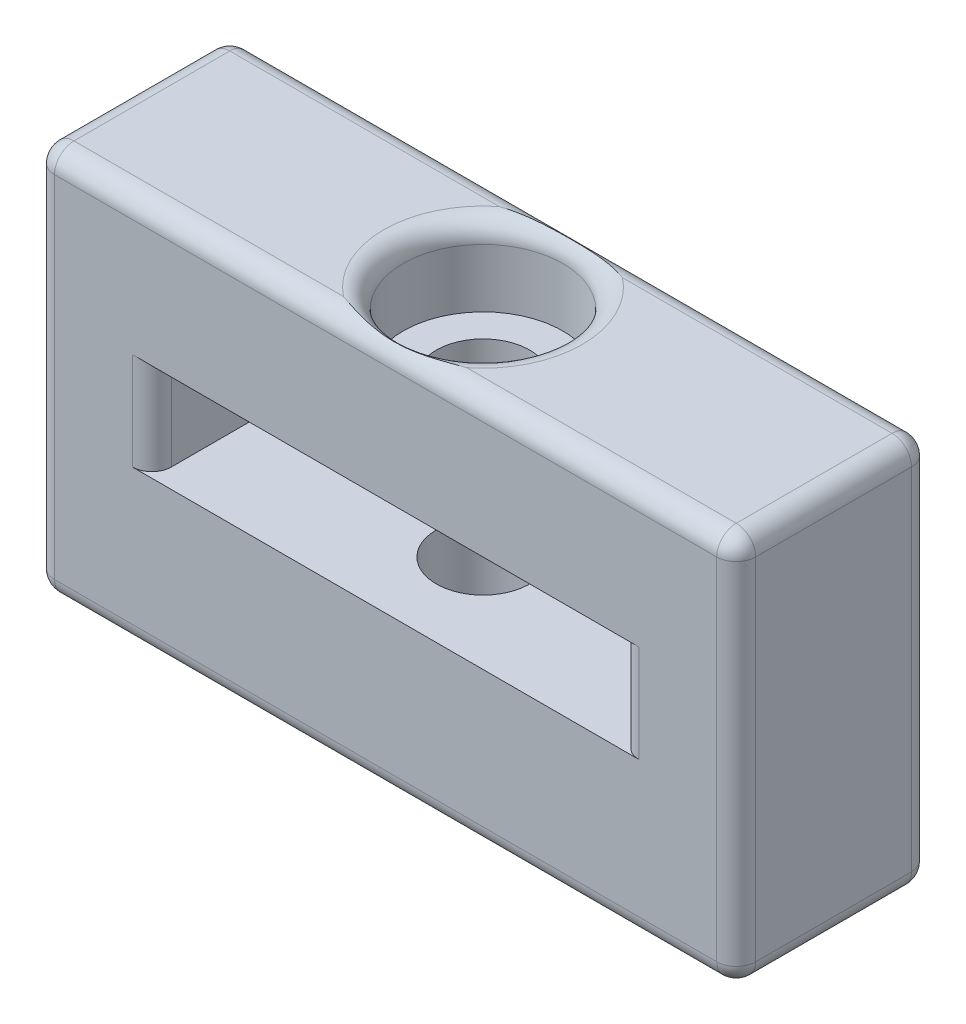
from build123d import *

# Parameters (mm, degrees)
SKETCH1_W           = 12
SKETCH1_H           = 5
BOSS_EXTRUDE1_DEPTH = 4
SKETCH2_W           = 3
SKETCH2_H           = 6.5
BOSS_EXTRUDE2_DEPTH = 5
SKETCH3_W           = 18
SKETCH3_H           = 5
BOSS_EXTRUDE3_DEPTH = 3.5
CUT_EXTRUDE1_REACH  = 15.684
SKETCH4_R           = 1.2
SKETCH5_R           = 2.05
CUT_EXTRUDE2_DEPTH  = 2
FILLET1_R           = 0.5


with BuildPart() as part:
    # Sketch1 → Boss-Extrude1 (new body)
    with BuildSketch(Plane(origin=(0, 0, 0), x_dir=(1, 0, 0), z_dir=(0, 1, 0))):
        Rectangle(SKETCH1_W, SKETCH1_H)
    extrude(amount=BOSS_EXTRUDE1_DEPTH)

    # Sketch2 → Boss-Extrude2 (add)
    with BuildSketch(Plane.XY.offset(2.5)):
        with Locations((-7.5, 3.25)):
            Rectangle(SKETCH2_W, SKETCH2_H)
        with Locations((7.5, 3.25)):
            Rectangle(SKETCH2_W, SKETCH2_H)
    extrude(amount=-BOSS_EXTRUDE2_DEPTH)

    # Sketch3 → Boss-Extrude3 (add)
    with BuildSketch(Plane(origin=(0, 6.5, 0), x_dir=(1, 0, 0), z_dir=(0, 1, 0))):
        Rectangle(SKETCH3_W, SKETCH3_H)
    extrude(amount=BOSS_EXTRUDE3_DEPTH)

    # Cut-Extrude1: up to this face of the body (flat: up to its plane)
    cut_extrude1_end = Plane(part.part.faces().sort_by_distance((0, 0, 0))[0])
    # Sketch4 → Cut-Extrude1 (cut, up to the picked face)
    with BuildSketch(Plane(origin=(0, 10, 0), x_dir=(1, 0, 0), z_dir=(0, 1, 0)), mode=Mode.PRIVATE) as cut_extrude1_sk1:
        with Locations(Location((0, 0, 0), (0, 0, 270))):
            Circle(SKETCH4_R)
    cut_extrude1_tool1 = split(extrude(cut_extrude1_sk1.sketch, amount=-CUT_EXTRUDE1_REACH, mode=Mode.PRIVATE), bisect_by=cut_extrude1_end, keep=Keep.BOTH, mode=Mode.PRIVATE)
    add(cut_extrude1_tool1.solids().sort_by(Axis((0, 10, 0), (0, -1, 0)))[0], mode=Mode.SUBTRACT)

    # Sketch5 → Cut-Extrude2 (cut)
    with BuildSketch(Plane(origin=(0, 10, 0), x_dir=(1, 0, 0), z_dir=(0, 1, 0))):
        with Locations(Location((0, 0, 0), (0, 0, 270))):
            Circle(SKETCH5_R)
    extrude(amount=-CUT_EXTRUDE2_DEPTH, mode=Mode.SUBTRACT)

    # Fillet1
    # the kernel refuses this fillet: 0.5 mm, written as the material it takes off along each edge
    with BuildSketch(Plane(origin=(-8.5, 0.5, 2), x_dir=(0, -1, 0), z_dir=(0, 0, 1))) as fillet1_piece_1_section:
        Polygon((0, 0), (FILLET1_R, 0), (FILLET1_R, -FILLET1_R), (0, -FILLET1_R), align=None)
    fillet1_piece_1 = extrude(amount=FILLET1_R, mode=Mode.PRIVATE)
    fillet1_piece_1 = fillet1_piece_1 - Plane(origin=(-8.5, 0.5, 2), x_dir=(0.7071067811865475, 0.7071067811865475, 0), z_dir=(0, 0, 1)) * Sphere(FILLET1_R, mode=Mode.PRIVATE)
    add(fillet1_piece_1, mode=Mode.SUBTRACT)
    with BuildSketch(Plane(origin=(-8.5, 0.5, -2), x_dir=(-1, 0, 0), z_dir=(0, -1, 0))) as fillet1_piece_2_section:
        Polygon((0, 0), (FILLET1_R, 0), (FILLET1_R, FILLET1_R), (0, FILLET1_R), align=None)
    fillet1_piece_2 = extrude(amount=FILLET1_R, mode=Mode.PRIVATE)
    fillet1_piece_2 = fillet1_piece_2 - Plane(origin=(-8.5, 0.5, -2), x_dir=(0.7071067811865475, 0, 0.7071067811865475), z_dir=(0, -1, 0)) * Sphere(FILLET1_R, mode=Mode.PRIVATE)
    add(fillet1_piece_2, mode=Mode.SUBTRACT)
    with BuildSketch(Plane(origin=(-8.5, 9.5, 2), x_dir=(-1, 0, 0), z_dir=(0, 0, 1))) as fillet1_piece_3_section:
        Polygon((0, 0), (FILLET1_R, 0), (FILLET1_R, -FILLET1_R), (0, -FILLET1_R), align=None)
    fillet1_piece_3 = extrude(amount=FILLET1_R, mode=Mode.PRIVATE)
    fillet1_piece_3 = fillet1_piece_3 - Plane(origin=(-8.5, 9.5, 2), x_dir=(0.7071067811865475, -0.7071067811865475, 0), z_dir=(0, 0, 1)) * Sphere(FILLET1_R, mode=Mode.PRIVATE)
    add(fillet1_piece_3, mode=Mode.SUBTRACT)
    with BuildSketch(Plane(origin=(-8.5, 9.5, -2), x_dir=(-1, 0, 0), z_dir=(0, 0, -1))) as fillet1_piece_4_section:
        Polygon((0, 0), (FILLET1_R, 0), (FILLET1_R, FILLET1_R), (0, FILLET1_R), align=None)
    fillet1_piece_4 = extrude(amount=FILLET1_R, mode=Mode.PRIVATE)
    fillet1_piece_4 = fillet1_piece_4 - Plane(origin=(-8.5, 9.5, -2), x_dir=(0.7071067811865475, -0.7071067811865475, 0), z_dir=(0, 0, -1)) * Sphere(FILLET1_R, mode=Mode.PRIVATE)
    add(fillet1_piece_4, mode=Mode.SUBTRACT)
    with BuildSketch(Plane(origin=(8.5, 0.5, 2), x_dir=(0, -1, 0), z_dir=(0, 0, 1))) as fillet1_piece_5_section:
        Polygon((0, 0), (FILLET1_R, 0), (FILLET1_R, FILLET1_R), (0, FILLET1_R), align=None)
    fillet1_piece_5 = extrude(amount=FILLET1_R, mode=Mode.PRIVATE)
    fillet1_piece_5 = fillet1_piece_5 - Plane(origin=(8.5, 0.5, 2), x_dir=(-0.7071067811865476, 0.7071067811865475, 0), z_dir=(0, 0, 1)) * Sphere(FILLET1_R, mode=Mode.PRIVATE)
    add(fillet1_piece_5, mode=Mode.SUBTRACT)
    with BuildSketch(Plane(origin=(8.5, 0.5, -2), x_dir=(1, 0, 0), z_dir=(0, -1, 0))) as fillet1_piece_6_section:
        Polygon((0, 0), (FILLET1_R, 0), (FILLET1_R, -FILLET1_R), (0, -FILLET1_R), align=None)
    fillet1_piece_6 = extrude(amount=FILLET1_R, mode=Mode.PRIVATE)
    fillet1_piece_6 = fillet1_piece_6 - Plane(origin=(8.5, 0.5, -2), x_dir=(-0.7071067811865475, 0, 0.7071067811865475), z_dir=(0, -1, 0)) * Sphere(FILLET1_R, mode=Mode.PRIVATE)
    add(fillet1_piece_6, mode=Mode.SUBTRACT)
    with BuildSketch(Plane(origin=(8.5, 9.5, 2), x_dir=(0, 1, 0), z_dir=(0, 0, 1))) as fillet1_piece_7_section:
        Polygon((0, 0), (FILLET1_R, 0), (FILLET1_R, -FILLET1_R), (0, -FILLET1_R), align=None)
    fillet1_piece_7 = extrude(amount=FILLET1_R, mode=Mode.PRIVATE)
    fillet1_piece_7 = fillet1_piece_7 - Plane(origin=(8.5, 9.5, 2), x_dir=(-0.7071067811865475, -0.7071067811865477, 0), z_dir=(0, 0, 1)) * Sphere(FILLET1_R, mode=Mode.PRIVATE)
    add(fillet1_piece_7, mode=Mode.SUBTRACT)
    with BuildSketch(Plane(origin=(8.5, 9.5, -2), x_dir=(0, 1, 0), z_dir=(0, 0, -1))) as fillet1_piece_8_section:
        Polygon((0, 0), (FILLET1_R, 0), (FILLET1_R, FILLET1_R), (0, FILLET1_R), align=None)
    fillet1_piece_8 = extrude(amount=FILLET1_R, mode=Mode.PRIVATE)
    fillet1_piece_8 = fillet1_piece_8 - Plane(origin=(8.5, 9.5, -2), x_dir=(-0.7071067811865475, -0.7071067811865477, 0), z_dir=(0, 0, -1)) * Sphere(FILLET1_R, mode=Mode.PRIVATE)
    add(fillet1_piece_8, mode=Mode.SUBTRACT)
    with BuildSketch(Plane(origin=(-9, 0, 2), x_dir=(1, 0, 0), z_dir=(0, 0, -1)), Plane(origin=(-9, 10, 2), x_dir=(0, -1, 0), z_dir=(0, 0, -1))) as fillet1_piece_9:
        with BuildLine():
            CenterArc((FILLET1_R, -FILLET1_R), FILLET1_R, 90, 90)
            Line((0, -FILLET1_R), (0, 0))
            Line((0, 0), (FILLET1_R, 0))
        make_face()
    extrude(amount=4, mode=Mode.SUBTRACT)
    with BuildSketch(Plane(origin=(-6, 4, 2.5), x_dir=(-1, 0, 0), z_dir=(0, 1, 0)), Plane(origin=(-6, 4, -2.5), x_dir=(0, 0, 1), z_dir=(0, 1, 0))) as fillet1_piece_10:
        with BuildLine():
            CenterArc((FILLET1_R, -FILLET1_R), FILLET1_R, 90, 90)
            Line((0, -FILLET1_R), (0, 0))
            Line((0, 0), (FILLET1_R, 0))
        make_face()
    extrude(amount=2.5, mode=Mode.SUBTRACT)
    with BuildSketch(Plane(origin=(-9, 9.5, 2.5), x_dir=(1, 0, 0), z_dir=(0, -1, 0)), Plane(origin=(-9, 9.5, -2.5), x_dir=(0, 0, 1), z_dir=(0, -1, 0)), Plane(origin=(9, 0.5, 2.5), x_dir=(-1, 0, 0), z_dir=(0, 1, 0)), Plane(origin=(9, 0.5, -2.5), x_dir=(0, 0, 1), z_dir=(0, 1, 0))) as fillet1_piece_11:
        with BuildLine():
            CenterArc((FILLET1_R, -FILLET1_R), FILLET1_R, 90, 90)
            Line((0, -FILLET1_R), (0, 0))
            Line((0, 0), (FILLET1_R, 0))
        make_face()
    extrude(amount=9, mode=Mode.SUBTRACT)
    with BuildSketch(Plane(origin=(9, 0, 2), x_dir=(-1, 0, 0), z_dir=(0, 0, -1)), Plane(origin=(9, 10, -2), x_dir=(-1, 0, 0), z_dir=(0, 0, 1))) as fillet1_piece_12:
        with BuildLine():
            CenterArc((FILLET1_R, FILLET1_R), FILLET1_R, 180, 90)
            Line((0, FILLET1_R), (0, 0))
            Line((0, 0), (FILLET1_R, 0))
        make_face()
    extrude(amount=4, mode=Mode.SUBTRACT)
    with BuildSketch(Plane(origin=(6, 4, 2.5), x_dir=(1, 0, 0), z_dir=(0, 1, 0)), Plane(origin=(6, 4, -2.5), x_dir=(0, 0, 1), z_dir=(0, 1, 0))) as fillet1_piece_13:
        with BuildLine():
            CenterArc((FILLET1_R, FILLET1_R), FILLET1_R, 180, 90)
            Line((0, FILLET1_R), (0, 0))
            Line((0, 0), (FILLET1_R, 0))
        make_face()
    extrude(amount=2.5, mode=Mode.SUBTRACT)
    with BuildSketch(Plane(origin=(8.5, 10, 2.5), x_dir=(0, -1, 0), z_dir=(-1, 0, 0)), Plane(origin=(-8.5, 0, 2.5), x_dir=(0, 1, 0), z_dir=(1, 0, 0)), Plane(origin=(-8.5, 0, -2.5), x_dir=(0, 0, 1), z_dir=(1, 0, 0))) as fillet1_piece_14:
        with BuildLine():
            CenterArc((FILLET1_R, -FILLET1_R), FILLET1_R, 90, 90)
            Line((0, -FILLET1_R), (0, 0))
            Line((0, 0), (FILLET1_R, 0))
        make_face()
    extrude(amount=17, mode=Mode.SUBTRACT)
    with BuildSketch(Plane(origin=(-8.5, 10, -2.5), x_dir=(0, 0, 1), z_dir=(1, 0, 0))) as fillet1_piece_15:
        with BuildLine():
            CenterArc((FILLET1_R, FILLET1_R), FILLET1_R, 180, 90)
            Line((0, FILLET1_R), (0, 0))
            Line((0, 0), (FILLET1_R, 0))
        make_face()
    extrude(amount=17, mode=Mode.SUBTRACT)
    with BuildSketch(Plane(origin=(0, 10, 0), x_dir=(0, 0, 1), z_dir=(-1, 0, 0))) as fillet1_piece_16:
        with BuildLine():
            CenterArc((2.05 + FILLET1_R, -FILLET1_R), FILLET1_R, 90, 90)
            Line((2.05, -FILLET1_R), (2.05, 0))
            Line((2.05, 0), (2.05 + FILLET1_R, 0))
        make_face()
    revolve(axis=Axis((0, 10, 0), (0, 1, 0)), mode=Mode.SUBTRACT)


solid = part.part
